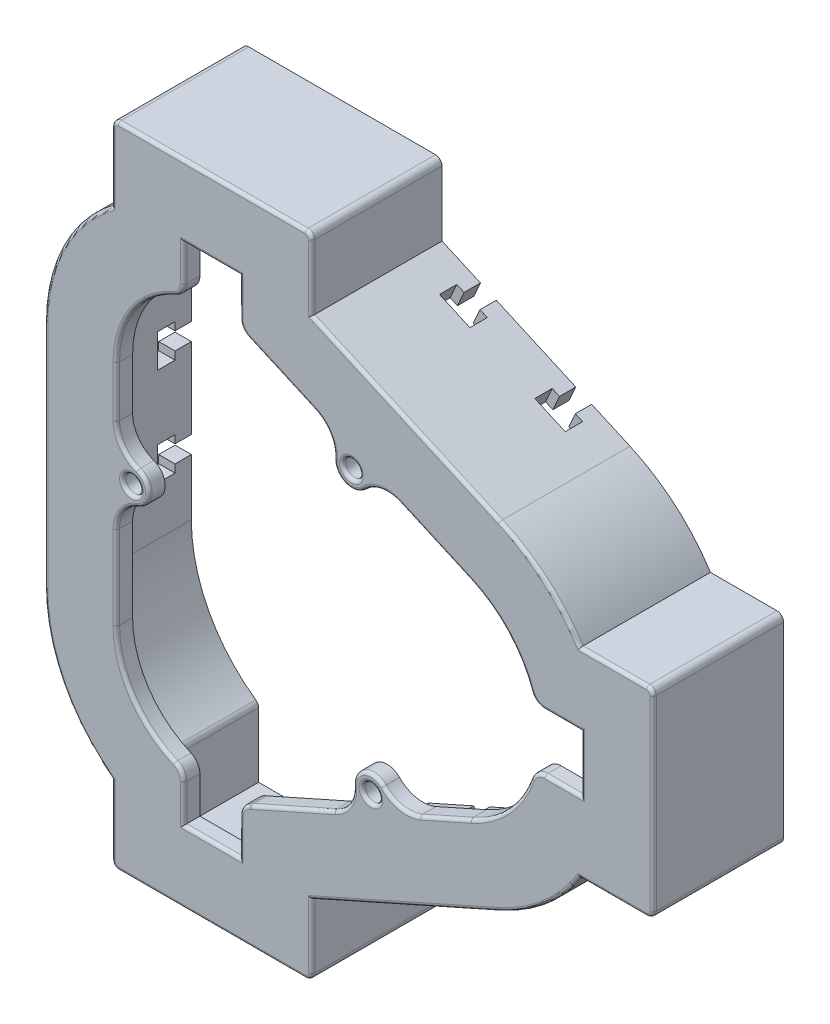
from build123d import *

# Parameters (mm, degrees)
SKETCH1_R           = 3.3782
BOSS_EXTRUDE1_DEPTH = 6.35
BOSS_EXTRUDE2_DEPTH = 50.8
CUT_EXTRUDE1_DEPTH  = 18.542
CUT_EXTRUDE2_DEPTH  = 18.542
FILLET1_R           = 12.7
FILLET2_R           = 2.54
FILLET3_R           = 1.27


with BuildPart() as part:
    # Sketch1 → Boss-Extrude1 (new body)
    with BuildSketch(Plane(origin=(0, 0, -80.01), x_dir=(-1, 0, 0), z_dir=(0, 0, -1))):
        with BuildLine():
            ThreePointArc((57.033048569, -59.752507142), (76.310939467, -36.760445876), (83.226798569, -7.563821901))
            Line((83.226798569, -7.563821901), (83.226798569, 81.336178099))
            ThreePointArc((83.226798569, 81.336178099), (76.310939467, 110.532802074), (57.033048569, 133.52486334))
            Line((57.033048569, 133.52486334), (57.033048569, 163.109312576))
            Line((57.033048569, 163.109312576), (-20.754451431, 163.109312576))
            Line((-20.754451431, 163.109312576), (-20.754451431, 135.265698217))
            Line((-20.754451431, 135.265698217), (-93.957455774, 102.667693744))
            ThreePointArc((-93.957455774, 102.667693744), (-111.579245978, 91.514788164), (-125.266063418, 75.779928099))
            Line((-125.266063418, 75.779928099), (-153.72728746, 75.779928099))
            Line((-153.72728746, 75.779928099), (-153.72728746, -2.007571901))
            Line((-153.72728746, -2.007571901), (-125.266063418, -2.007571901))
            ThreePointArc((-125.266063418, -2.007571901), (-111.579245978, -17.742431966), (-93.957455774, -28.895337546))
            Line((-93.957455774, -28.895337546), (-20.754451431, -61.493342019))
            Line((-20.754451431, -61.493342019), (-20.754451431, -89.336956378))
            Line((-20.754451431, -89.336956378), (57.033048569, -89.336956378))
            Line((57.033048569, -89.336956378), (57.033048569, -59.752507142))
        make_face()
        with BuildLine():
            Line((55.286798569, 39.965228132), (55.286798569, -7.563821901))
            ThreePointArc((55.286798569, -7.563821901), (49.095548569, -28.097875134), (32.585548569, -41.787243956))
            ThreePointArc((32.585548569, -41.787243956), (30.045548569, -43.893300698), (29.093048569, -47.052385811))
            Line((29.093048569, -47.052385811), (29.093048569, -61.396956378))
            Line((29.093048569, -61.396956378), (7.185548569, -61.396956378))
            Line((7.185548569, -61.396956378), (7.185548569, -47.052385811))
            ThreePointArc((7.185548569, -47.052385811), (6.233048569, -43.893300698), (3.693048569, -41.787243956))
            ThreePointArc((3.693048569, -41.787243956), (3.359698295, -41.6446108), (3.027756074, -41.498730766))
            Line((3.027756074, -41.498730766), (-43.20886125, -20.909118743))
            ThreePointArc((-43.20886125, -20.909118743), (-41.056532995, -8.006979176), (-49.205885333, -18.238586029))
            Line((-49.205885333, -18.238586029), (-82.591509282, -3.371645409))
            ThreePointArc((-82.591509282, -3.371645409), (-97.010075674, 6.955786784), (-106.189719626, 22.130932563))
            ThreePointArc((-106.189719626, 22.130932563), (-108.278986772, 24.886309283), (-111.574858962, 25.932428099))
            Line((-111.574858962, 25.932428099), (-125.78728746, 25.932428099))
            Line((-125.78728746, 25.932428099), (-125.78728746, 47.839928099))
            Line((-125.78728746, 47.839928099), (-111.574858962, 47.839928099))
            ThreePointArc((-111.574858962, 47.839928099), (-108.278986772, 48.886046915), (-106.189719626, 51.641423635))
            ThreePointArc((-106.189719626, 51.641423635), (-97.010075674, 66.816569414), (-82.591509282, 77.144001607))
            Line((-82.591509282, 77.144001607), (-41.755458339, 95.328689287))
            ThreePointArc((-41.755458339, 95.328689287), (-33.488036391, 85.259115367), (-35.440943929, 98.140603509))
            Line((-35.440943929, 98.140603509), (3.027756074, 115.271086964))
            ThreePointArc((3.027756074, 115.271086964), (3.359698295, 115.416966998), (3.693048569, 115.559600155))
            ThreePointArc((3.693048569, 115.559600155), (6.233048569, 117.665656896), (7.185548569, 120.824742009))
            Line((7.185548569, 120.824742009), (7.185548569, 135.169312576))
            Line((7.185548569, 135.169312576), (29.093048569, 135.169312576))
            Line((29.093048569, 135.169312576), (29.093048569, 120.824742009))
            ThreePointArc((29.093048569, 120.824742009), (30.045548569, 117.665656896), (32.585548569, 115.559600155))
            ThreePointArc((32.585548569, 115.559600155), (49.095548569, 101.870231332), (55.286798569, 81.336178099))
            Line((55.286798569, 81.336178099), (55.286798569, 46.52998577))
            ThreePointArc((55.286798569, 46.52998577), (42.624898569, 43.247606951), (55.286798569, 39.965228132))
        make_face(mode=Mode.SUBTRACT)
        with Locations((49.381298569, 43.247606951)):
            Circle(SKETCH1_R, mode=Mode.SUBTRACT)
        with Locations((-43.80502551, -14.179072002)):
            Circle(SKETCH1_R, mode=Mode.SUBTRACT)
        with Locations((-36.236528907, 91.431208193)):
            Circle(SKETCH1_R, mode=Mode.SUBTRACT)
    extrude(amount=BOSS_EXTRUDE1_DEPTH)

    # Sketch1<3> → Boss-Extrude2 (add)
    with BuildSketch(Plane(origin=(0, 0, -80.01), x_dir=(-1, 0, 0), z_dir=(0, 0, -1))):
        with BuildLine():
            ThreePointArc((57.033048569, -59.752507142), (76.310939467, -36.760445876), (83.226798569, -7.563821901))
            Line((83.226798569, -7.563821901), (83.226798569, 81.336178099))
            ThreePointArc((83.226798569, 81.336178099), (76.310939467, 110.532802074), (57.033048569, 133.52486334))
            Line((57.033048569, 133.52486334), (57.033048569, 163.109312576))
            Line((57.033048569, 163.109312576), (22.108048569, 163.109312576))
            Line((22.108048569, 163.109312576), (14.170548569, 163.109312576))
            Line((14.170548569, 163.109312576), (-20.754451431, 163.109312576))
            Line((-20.754451431, 163.109312576), (-20.754451431, 135.265698217))
            Line((-20.754451431, 135.265698217), (-93.957455774, 102.667693744))
            ThreePointArc((-93.957455774, 102.667693744), (-111.579245978, 91.514788164), (-125.266063418, 75.779928099))
            Line((-125.266063418, 75.779928099), (-153.72728746, 75.779928099))
            Line((-153.72728746, 75.779928099), (-153.72728746, 40.854928099))
            Line((-153.72728746, 40.854928099), (-153.72728746, 32.917428099))
            Line((-153.72728746, 32.917428099), (-153.72728746, -2.007571901))
            Line((-153.72728746, -2.007571901), (-125.266063418, -2.007571901))
            ThreePointArc((-125.266063418, -2.007571901), (-111.579245978, -17.742431966), (-93.957455774, -28.895337546))
            Line((-93.957455774, -28.895337546), (-20.754451431, -61.493342019))
            Line((-20.754451431, -61.493342019), (-20.754451431, -89.336956378))
            Line((-20.754451431, -89.336956378), (14.170548569, -89.336956378))
            Line((14.170548569, -89.336956378), (22.108048569, -89.336956378))
            Line((22.108048569, -89.336956378), (57.033048569, -89.336956378))
            Line((57.033048569, -89.336956378), (57.033048569, -59.752507142))
        make_face()
        with BuildLine():
            Line((76.876798569, 81.336178099), (76.876798569, -7.563821901))
            ThreePointArc((76.876798569, -7.563821901), (69.915897636, -35.299677671), (50.683048569, -56.46165664))
            Line((50.683048569, -56.46165664), (50.683048569, -82.986956378))
            Line((50.683048569, -82.986956378), (22.108048569, -82.986956378))
            Line((22.108048569, -82.986956378), (14.170548569, -82.986956378))
            Line((14.170548569, -82.986956378), (-14.404451431, -82.986956378))
            Line((-14.404451431, -82.986956378), (-14.404451431, -57.36990881))
            Line((-14.404451431, -57.36990881), (-91.374286117, -23.094498424))
            ThreePointArc((-91.374286117, -23.094498424), (-108.722690302, -11.79609352), (-121.690697129, 4.342428099))
            Line((-121.690697129, 4.342428099), (-147.37728746, 4.342428099))
            Line((-147.37728746, 4.342428099), (-147.37728746, 32.917428099))
            Line((-147.37728746, 32.917428099), (-147.37728746, 40.854928099))
            Line((-147.37728746, 40.854928099), (-147.37728746, 69.429928099))
            Line((-147.37728746, 69.429928099), (-121.690697129, 69.429928099))
            ThreePointArc((-121.690697129, 69.429928099), (-108.722690302, 85.568449718), (-91.374286117, 96.866854622))
            Line((-91.374286117, 96.866854622), (-14.404451431, 131.142265008))
            Line((-14.404451431, 131.142265008), (-14.404451431, 156.759312576))
            Line((-14.404451431, 156.759312576), (14.170548569, 156.759312576))
            Line((14.170548569, 156.759312576), (22.108048569, 156.759312576))
            Line((22.108048569, 156.759312576), (50.683048569, 156.759312576))
            Line((50.683048569, 156.759312576), (50.683048569, 130.234012838))
            ThreePointArc((50.683048569, 130.234012838), (69.915897636, 109.072033869), (76.876798569, 81.336178099))
        make_face(mode=Mode.SUBTRACT)
    extrude(amount=BOSS_EXTRUDE2_DEPTH)

    # Sketch3 → Cut-Extrude1 (cut)
    with BuildSketch(Plane(origin=(53.701665887, 120.593985576, 0), x_dir=(0.9135179719941336, -0.40679837124025636, 0), z_dir=(0.40679837124025636, 0.9135179719941336, 0))):
        Polygon((20.94203626, 130.81), (20.94203626, 124.46), (17.84323626, 124.46), (17.84323626, 117.7036), (30.79723626, 117.7036), (30.79723626, 124.46), (27.69843626, 124.46), (27.69843626, 130.81), align=None)
        Polygon((-19.69796374, 130.81), (-19.69796374, 124.46), (-22.79676374, 124.46), (-22.79676374, 117.7036), (-9.84276374, 117.7036), (-9.84276374, 124.46), (-12.94156374, 124.46), (-12.94156374, 130.81), align=None)
    cut_extrude1 = extrude(amount=-CUT_EXTRUDE1_DEPTH, mode=Mode.SUBTRACT)

    # Mirror1: Cut-Extrude1 across plane
    add(cut_extrude1.mirror(Plane.ZX.offset(36.886178099)), mode=Mode.SUBTRACT)

    # Sketch2 → Cut-Extrude2 (cut)
    with BuildSketch(Plane.ZY.offset(83.226798569)):
        Polygon((-130.81, 395.457978099), (-130.81, 402.214378099), (-124.46, 402.214378099), (-124.46, 405.313178099), (-117.602, 405.313178099), (-117.602, 392.359178099), (-124.46, 392.359178099), (-124.46, 395.457978099), align=None)
        Polygon((-130.81, 52.557978099), (-124.46, 52.557978099), (-124.46, 49.459178099), (-117.602, 49.459178099), (-117.602, 62.413178099), (-124.46, 62.413178099), (-124.46, 59.314378099), (-130.81, 59.314378099), align=None)
        Polygon((-130.81, 14.457978099), (-124.46, 14.457978099), (-124.46, 11.359178099), (-117.602, 11.359178099), (-117.602, 24.313178099), (-124.46, 24.313178099), (-124.46, 21.214378099), (-130.81, 21.214378099), align=None)
        Polygon((-130.81, 433.557978099), (-130.81, 440.314378099), (-124.46, 440.314378099), (-124.46, 443.413178099), (-117.602, 443.413178099), (-117.602, 430.459178099), (-124.46, 430.459178099), (-124.46, 433.557978099), align=None)
    extrude(amount=-CUT_EXTRUDE2_DEPTH, mode=Mode.SUBTRACT)

    # Fillet1
    fillet1_edges = [part.edges().sort_by_distance(p)[0] for p in [
        (49.205885333, -18.238586029, -83.185),
        (43.20886125, -20.909118743, -83.185),
        (-55.286798569, 46.52998577, -83.185),
        (-55.286798569, 39.965228132, -83.185),
        (41.755458339, 95.328689287, -83.185),
        (35.440943929, 98.140603509, -83.185),
    ]]
    fillet(fillet1_edges, radius=FILLET1_R)

    # Fillet2
    fillet2_edges = [part.edges().sort_by_distance(p)[0] for p in [
        (147.37728746, 69.429928099, -108.585),
        (147.37728746, 4.342428099, -108.585),
        (14.404451431, 156.759312576, -108.585),
        (-50.683048569, 156.759312576, -108.585),
        (14.404451431, 131.142265008, -108.585),
        (-50.683048569, 130.234012838, -108.585),
        (14.404451431, -57.36990881, -108.585),
        (-50.683048569, -56.46165664, -108.585),
        (20.754451431, -89.336956378, -105.41),
        (-57.033048569, -89.336956378, -105.41),
        (-57.033048569, 163.109312576, -105.41),
        (20.754451431, 163.109312576, -105.41),
        (153.72728746, 75.779928099, -105.41),
        (153.72728746, -2.007571901, -105.41),
        (121.690697129, 4.342428099, -108.585),
        (121.690697129, 69.429928099, -108.585),
    ]]
    fillet(fillet2_edges, radius=FILLET2_R)

    # Fillet3
    fillet3_edges = [part.edges().sort_by_distance(p)[0] for p in [
        (-56.289099793, -88.593007602, -80.01),
        (-57.033048569, -73.27473176, -80.01),
        (-76.310939467, -36.760445876, -80.01),
        (-83.226798569, 36.886178099, -80.01),
        (-76.310939467, 110.532802074, -80.01),
        (-57.033048569, 147.047087958, -80.01),
        (-56.289099793, 162.3653638, -80.01),
        (-18.139298569, 163.109312576, -80.01),
        (20.010502655, 162.3653638, -80.01),
        (20.754451431, 147.917505396, -80.01),
        (57.355953602, 118.966695981, -80.01),
        (111.579245978, 91.514788164, -80.01),
        (138.226675439, 75.779928099, -80.01),
        (152.983338684, 75.035979323, -80.01),
        (153.72728746, 36.886178099, -80.01),
        (152.983338684, -1.263623125, -80.01),
        (138.226675439, -2.007571901, -80.01),
        (111.579245978, -17.742431966, -80.01),
        (57.355953602, -45.194339782, -80.01),
        (20.754451431, -74.145149198, -80.01),
        (20.010502655, -88.593007602, -80.01),
        (-18.139298569, -89.336956378, -80.01),
        (39.614728907, 91.431208193, -80.01),
        (-46.003098569, 43.247606951, -80.01),
        (47.18322551, -14.179072002, -80.01),
        (118.681073211, 47.839928099, -80.01),
        (108.278986772, 48.886046915, -80.01),
        (97.010075674, 66.816569414, -80.01),
        (68.905076481, 83.23870225, -80.01),
        (47.711951698, 90.214222371, -80.01),
        (33.488036391, 85.259115367, -80.01),
        (27.654618084, 99.145946645, -80.01),
        (9.475001257, 109.703488434, -80.01),
        (-3.359698295, 115.416966998, -80.01),
        (-6.233048569, 117.665656896, -80.01),
        (-7.185548569, 127.997027293, -80.01),
        (-18.139298569, 135.169312576, -80.01),
        (-29.093048569, 127.997027293, -80.01),
        (-30.045548569, 117.665656896, -80.01),
        (-49.095548569, 101.870231332, -80.01),
        (-55.286798569, 71.407624403, -80.01),
        (-53.017885837, 54.234595681, -80.01),
        (-42.624898569, 43.247606951, -80.01),
        (-53.017885837, 32.260618221, -80.01),
        (-55.286798569, 8.726160647, -80.01),
        (-49.095548569, -28.097875134, -80.01),
        (-30.045548569, -43.893300698, -80.01),
        (-29.093048569, -54.224671095, -80.01),
        (-18.139298569, -61.396956378, -80.01),
        (-7.185548569, -54.224671095, -80.01),
        (-6.233048569, -43.893300698, -80.01),
        (-3.359698295, -41.6446108, -80.01),
        (13.26242371, -34.244556457, -80.01),
        (35.247571624, -21.970648949, -80.01),
        (41.056532995, -8.006979176, -80.01),
        (55.321194951, -13.031670708, -80.01),
        (72.726826185, -7.764484017, -80.01),
        (97.010075674, 6.955786784, -80.01),
        (108.278986772, 24.886309283, -80.01),
        (118.681073211, 25.932428099, -80.01),
        (125.78728746, 36.886178099, -80.01),
    ]]
    fillet(fillet3_edges, radius=FILLET3_R)


solid = part.part
